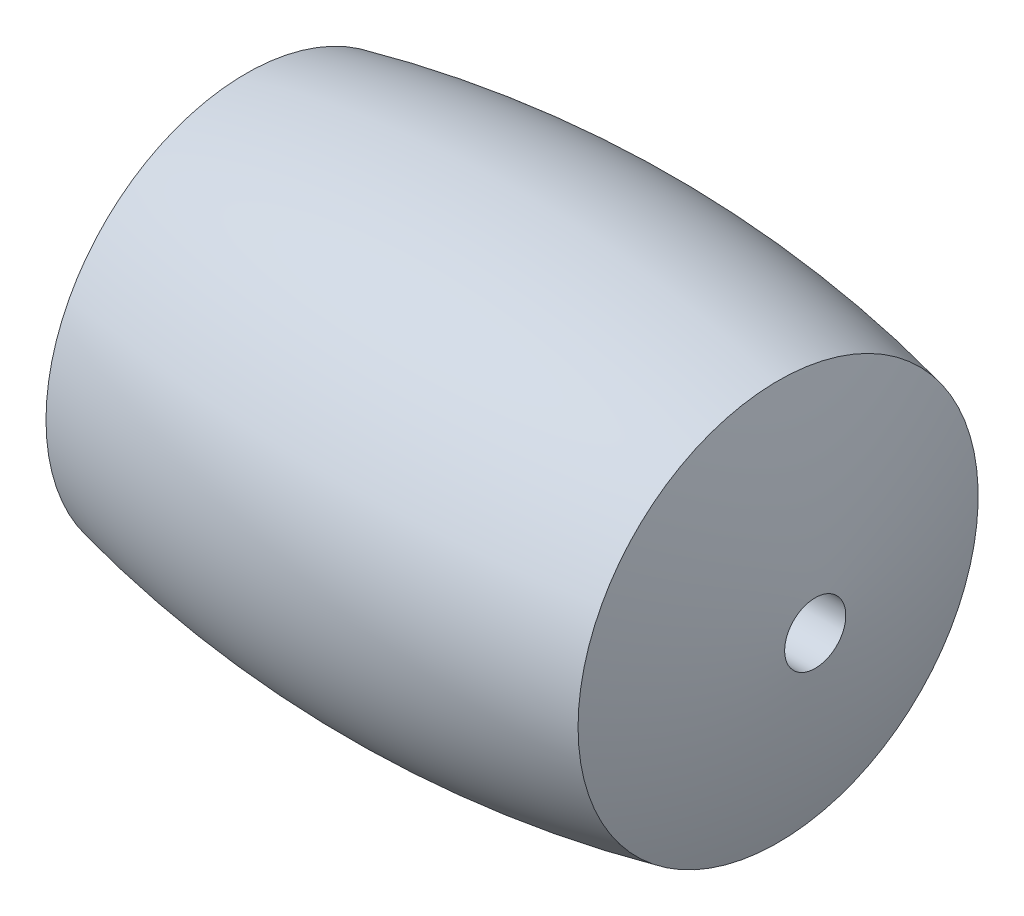
from build123d import *

# Parameters (mm, degrees)
CUT_EXTRUDE1_START     = -6.3500001
CUT_EXTRUDE1_OUTLINE_R = 0.635
CUT_EXTRUDE1_DEPTH     = 12.7000002


# Read off the part's stored shape, not the designer's step: Cut-Extrude1
with BuildPart() as part:
    # Sketch1 → Revolve1 (revolve)
    with BuildSketch(Plane(origin=(0, 0, 0), x_dir=(1, 0, 0), z_dir=(0, 1, 0)), mode=Mode.PRIVATE) as revolve1_sk:
        with BuildLine():
            Line((-6.35, 0), (6.35, 0))
            ThreePointArc((6.35, 0), (6.071418462, 2.103871805), (5.524516579, 4.154428456))
            ThreePointArc((5.524516579, 4.154428456), (0, 4.7625), (-5.524516579, 4.154428456))
            ThreePointArc((-5.524516579, 4.154428456), (-6.071418462, 2.103871805), (-6.35, 0))
        make_face()
    revolve(revolve1_sk.sketch.rotate(Axis((-6.35, 0, 0), (1, 0, 0)), 180), axis=Axis((-6.35, 0, 0), (1, 0, 0)))

    # Cut-Extrude1 outline → Cut-Extrude1 (cut)
    with BuildSketch(Plane.YZ.offset(CUT_EXTRUDE1_START)):
        Circle(CUT_EXTRUDE1_OUTLINE_R)
    extrude(amount=CUT_EXTRUDE1_DEPTH, mode=Mode.SUBTRACT)


solid = part.part
